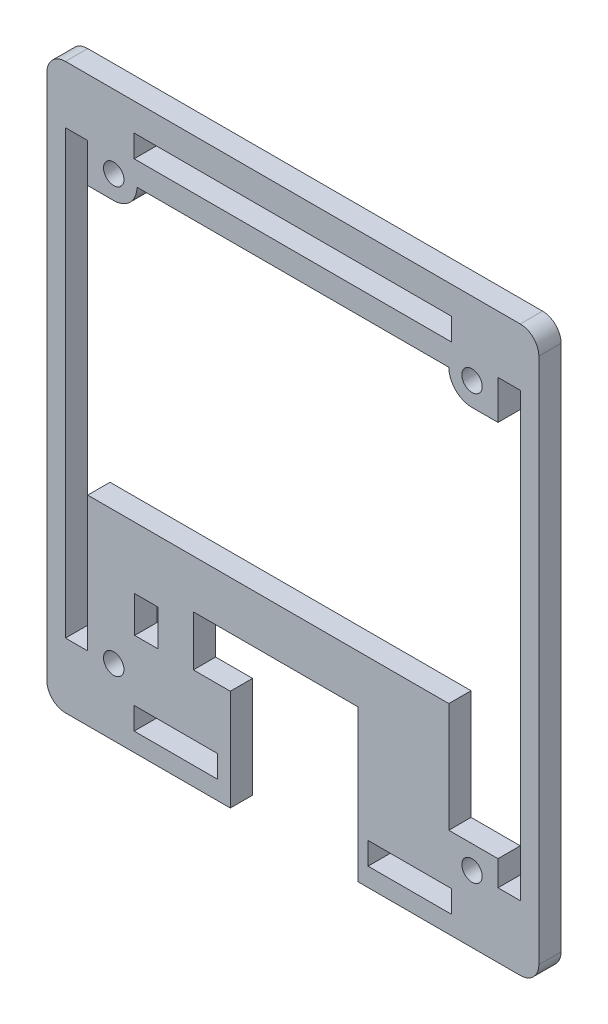
from build123d import *

# Parameters (mm, degrees)
SKETCH1_R           = 1.397
SKETCH1_W           = 3.175
SKETCH1_H           = 4.953
SKETCH1_W_2         = 11.43
SKETCH1_H_2         = 3.048
SKETCH1_W_3         = 43.434
BOSS_EXTRUDE1_DEPTH = 3.048
FILLET1_R           = 2.54


with BuildPart() as part:
    # Sketch1 → Boss-Extrude1 (new body)
    with BuildSketch(Plane.XY):
        Polygon((-3.7846, 71.611586257), (-3.7846, -5.588), (21.3106, -5.588), (21.3106, -4.3434), (21.3106, 8.255), (16.256, 8.255), (16.256, 15.1384), (38.7858, 15.1384), (38.7858, -4.3434), (38.7858, -5.588), (63.5254, -5.588), (63.5254, 71.611586257), align=None)
        with Locations((5.3594, 3.556)):
            Circle(SKETCH1_R, mode=Mode.SUBTRACT)
        with Locations((9.8171, 10.8077)):
            Rectangle(SKETCH1_W, SKETCH1_H, mode=Mode.SUBTRACT)
        with Locations((13.8684, -1.524)):
            Rectangle(SKETCH1_W_2, SKETCH1_H_2, mode=Mode.SUBTRACT)
        with Locations((45.8724, -1.524)):
            Rectangle(SKETCH1_W_2, SKETCH1_H_2, mode=Mode.SUBTRACT)
        with Locations((54.3814, 3.556)):
            Circle(SKETCH1_R, mode=Mode.SUBTRACT)
        with BuildLine():
            Line((-1.2446, 63.754), (1.8034, 63.754))
            Line((1.8034, 63.754), (1.8034, 58.42))
            Line((1.8034, 58.42), (5.3594, 58.42))
            ThreePointArc((5.3594, 58.42), (7.60446403, 59.34993597), (8.5344, 61.595))
            Line((8.5344, 61.595), (51.2064, 61.595))
            ThreePointArc((51.2064, 61.595), (52.13633597, 59.34993597), (54.3814, 58.42))
            Line((54.3814, 58.42), (57.9374, 58.42))
            Line((57.9374, 58.42), (57.9374, 63.754))
            Line((57.9374, 63.754), (60.9854, 63.754))
            Line((60.9854, 63.754), (60.9854, 3.2766))
            Line((60.9854, 3.2766), (57.9374, 3.2766))
            Line((57.9374, 3.2766), (57.9374, 6.731))
            Line((57.9374, 6.731), (51.2064, 6.731))
            Line((51.2064, 6.731), (51.2064, 21.7424))
            Line((51.2064, 21.7424), (1.8034, 21.7424))
            Line((1.8034, 21.7424), (1.8034, 3.2766))
            Line((1.8034, 3.2766), (-1.2446, 3.2766))
            Line((-1.2446, 3.2766), (-1.2446, 63.754))
        make_face(mode=Mode.SUBTRACT)
        with Locations((5.3594, 61.595)):
            Circle(SKETCH1_R, mode=Mode.SUBTRACT)
        with Locations((29.8704, 66.294)):
            Rectangle(SKETCH1_W_3, SKETCH1_H_2, mode=Mode.SUBTRACT)
        with Locations((54.3814, 61.595)):
            Circle(SKETCH1_R, mode=Mode.SUBTRACT)
    extrude(amount=BOSS_EXTRUDE1_DEPTH)

    # Fillet1
    fillet1_edges = [part.edges().sort_by_distance(p)[0] for p in [
        (-3.7846, -5.588, 1.524),
        (63.5254, -5.588, 1.524),
        (63.5254, 71.611586257, 1.524),
        (-3.7846, 71.611586257, 1.524),
    ]]
    fillet(fillet1_edges, radius=FILLET1_R)


solid = part.part
